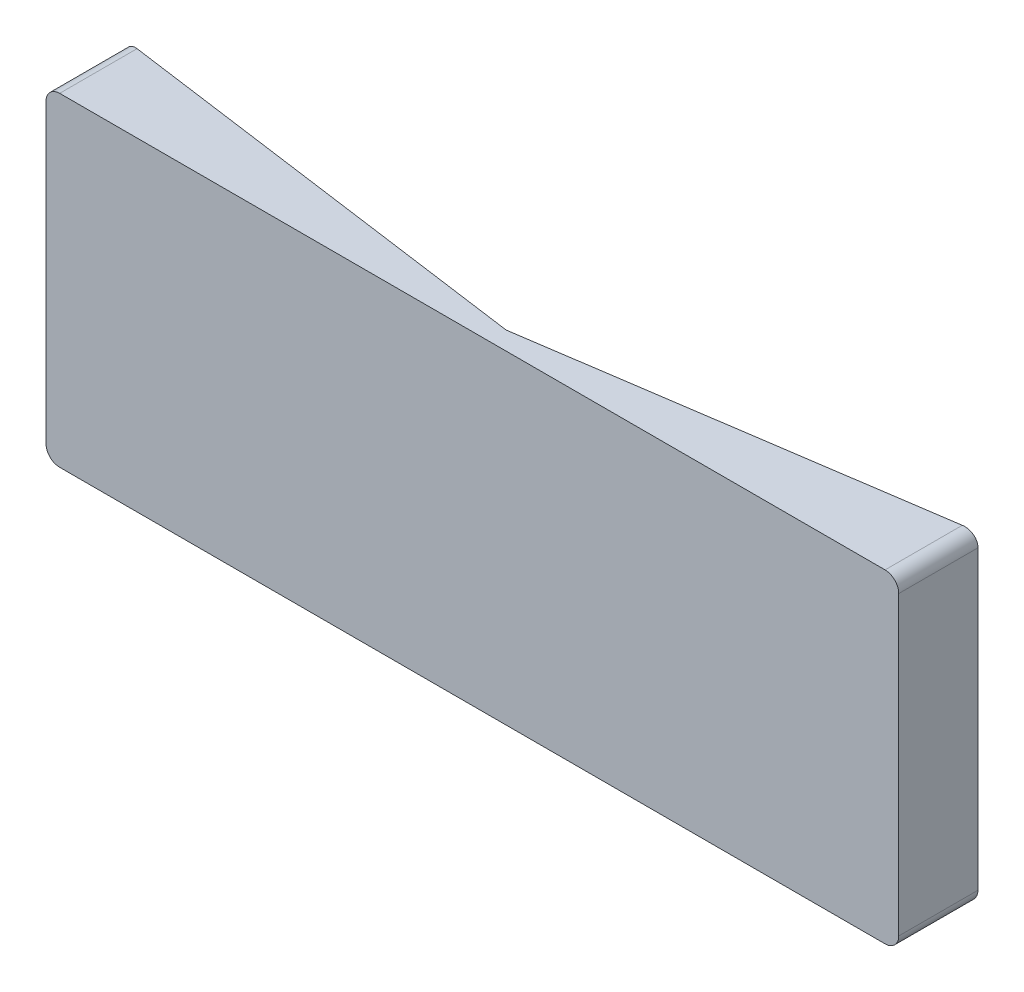
from build123d import *

# Parameters (mm, degrees)
BOSS_EXTRUDE1_DEPTH     = 14.732
SHELL1_START            = -57.658
SHELL1_OUTLINE_W        = 153.416
SHELL1_OUTLINE_H        = 12.192
SHELL1_DEPTH            = 55.118
CUT_EXTRUDE1_DEPTH      = 103.89414179
CUT_EXTRUDE1_DEPTH_BACK = 103.89414179


# Read off the part's stored shape, not the designer's step: Shell1
with BuildPart() as part:
    # Sketch1 → Boss-Extrude1 (new body)
    with BuildSketch(Plane.XY):
        with BuildLine():
            Line((-79.596309795, 0), (73.819690205, 0))
            ThreePointArc((73.819690205, 0), (75.615741429, -0.743948776), (76.359690205, -2.54))
            Line((76.359690205, -2.54), (76.359690205, -57.658))
            ThreePointArc((76.359690205, -57.658), (75.615741429, -59.454051224), (73.819690205, -60.198))
            Line((73.819690205, -60.198), (-79.596309795, -60.198))
            ThreePointArc((-79.596309795, -60.198), (-81.392361019, -59.454051224), (-82.136309795, -57.658))
            Line((-82.136309795, -57.658), (-82.136309795, -2.54))
            ThreePointArc((-82.136309795, -2.54), (-81.392361019, -0.743948776), (-79.596309795, 0))
        make_face()
    extrude(amount=BOSS_EXTRUDE1_DEPTH)

    # Shell1 outline → Shell1 (cut)
    with BuildSketch(Plane(origin=(0, 0, 0), x_dir=(1, 0, 0), z_dir=(0, 1, 0)).offset(SHELL1_START)):
        with Locations((-2.888309795, -6.096)):
            Rectangle(SHELL1_OUTLINE_W, SHELL1_OUTLINE_H)
    extrude(amount=SHELL1_DEPTH, mode=Mode.SUBTRACT)

    # Sketch3 → Cut-Extrude1 (cut, two sides: drawn at the far end of the back side and taken through both)
    with BuildSketch(Plane(origin=(0, 0, 0), x_dir=(1, 0, 0), z_dir=(0, 1, 0)).offset(-CUT_EXTRUDE1_DEPTH_BACK)):
        Polygon((76.359690205, 0), (0, -11.339454315), (-82.136309795, 0), align=None)
    extrude(amount=CUT_EXTRUDE1_DEPTH + CUT_EXTRUDE1_DEPTH_BACK, mode=Mode.SUBTRACT)


solid = part.part
